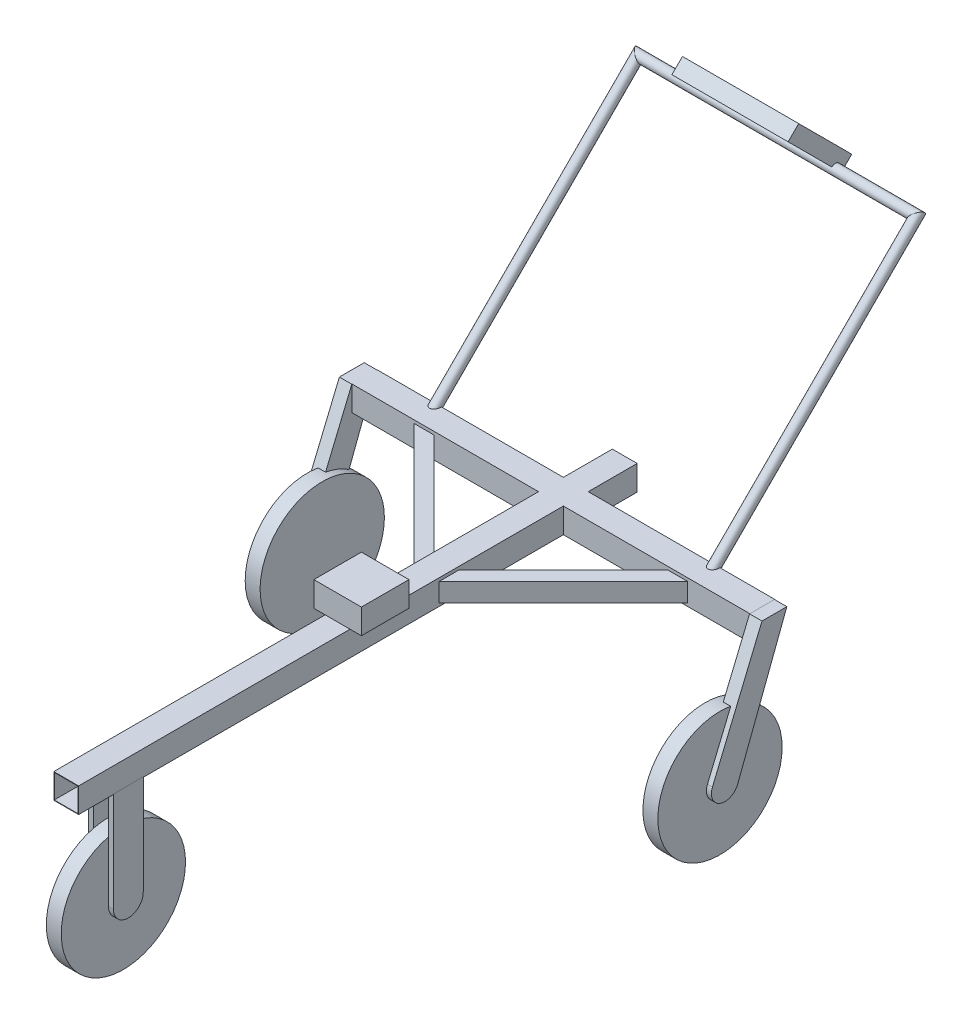
from build123d import *

# Parameters (mm, degrees)
FWD_AFT_BEAM_XS_W         = 50
FWD_AFT_BEAM_XS_H         = 50
FWD_AFT_BEAM_XS_W_2       = 48
FWD_AFT_BEAM_XS_H_2       = 48
LAT_BEAM_XS_W             = 50
LAT_BEAM_XS_H             = 50
LAT_BEAM_XS_W_2           = 48
LAT_BEAM_XS_H_2           = 48
FRONT_WHEEL_SKETCH_R      = 125
BOSS_EXTRUDE1_DEPTH       = 15
REAR_RIGHT_WHEEL_SKETCH_R = 125
BOSS_EXTRUDE2_DEPTH       = 15
REAR_LEFT_WHEEL_SKETCH_R  = 125
BOSS_EXTRUDE3_DEPTH       = 15
SWEEP1_PROFILE_R          = 10
SKETCH14_W                = 40.260144978
SKETCH14_H                = 37.28401926
BOSS_EXTRUDE4_START       = 25
BOSS_EXTRUDE4_DEPTH       = 10
BOSS_EXTRUDE5_START       = 400
BOSS_EXTRUDE5_DEPTH       = 25
SKETCH17_W                = 233.770866628
SKETCH17_H                = 150.987210946
BOSS_EXTRUDE6_DEPTH       = 30
SKETCH20_W                = 95.63546101
SKETCH20_H                = 95.635461009
BOSS_EXTRUDE7_DEPTH       = 50


# Read off the part's stored shape, not the designer's step: Boss-Extrude5
with BuildPart() as part:
    # fwd-aft-beam: sweep along a path in fwd-aft-beam-profile
    with BuildLine(Plane(origin=(0, 350, -250), x_dir=(1, 0, 0), z_dir=(0, -1, 0))) as fwd_aft_beam_path:
        Line((0, 1150), (0, 26.58102252))
    # fwd-aft-beam-xs → fwd-aft-beam (sweep)
    with BuildSketch(Plane.XY):
        with Locations((0, 350)):
            Rectangle(FWD_AFT_BEAM_XS_W, FWD_AFT_BEAM_XS_H)
        with Locations((0, 350)):
            Rectangle(FWD_AFT_BEAM_XS_W_2, FWD_AFT_BEAM_XS_H_2, mode=Mode.SUBTRACT)
    sweep(path=fwd_aft_beam_path.line)

    # lat-beam: sweep along a path in lat-beam-profile
    with BuildLine(Plane(origin=(0, 350, 0), x_dir=(1, 0, 0), z_dir=(0, 1, 0))) as lat_beam_path:
        Line((-400, 100), (400, 100))
    # lat-beam-xs → lat-beam (sweep)
    with BuildSketch(Plane(origin=(0, 0, 0), x_dir=(0, 0, -1), z_dir=(1, 0, 0))):
        with Locations((100, 350)):
            Rectangle(LAT_BEAM_XS_W, LAT_BEAM_XS_H)
        with Locations((100, 350)):
            Rectangle(LAT_BEAM_XS_W_2, LAT_BEAM_XS_H_2, mode=Mode.SUBTRACT)
    sweep(path=lat_beam_path.line)

    # Sweep1: sweep along a path in Sketch1
    with BuildLine(Plane(origin=(0, 125, 125), x_dir=(1, 0, 0), z_dir=(0, 0.7071067811865488, 0.7071067811865464))) as sweep1_path:
        Line((-280, 318.198051534), (-280, 926.610024364))
        Line((-280, 926.610024364), (280, 926.610024364))
        Line((280, 926.610024364), (280, 318.198051534))
    # Sweep1 profile (on start of the path) → Sweep1 (sweep)
    with BuildSketch(Plane(origin=(-280, 350, -100), x_dir=(0, -0.7071067811865488, -0.7071067811865464), z_dir=(0, 0.7071067811865464, -0.7071067811865488))):
        Circle(SWEEP1_PROFILE_R)
    sweep(path=sweep1_path.line, transition=Transition.RIGHT)

    # Sweep2: sweep along a path in frame-sketch
    with BuildLine(Plane(origin=(0, 350, 0), x_dir=(1, 0, 0), z_dir=(0, 1, 0))) as sweep2_path:
        Line((280, 100), (0, -180))
        Line((0, -180), (-280, 100))
    # Sketch14 → Sweep2 (sweep)
    with BuildSketch(Plane.XY.offset(-100)):
        with Locations((-280, 350)):
            Rectangle(SKETCH14_W, SKETCH14_H)
    sweep(path=sweep2_path.line, transition=Transition.RIGHT)


with BuildPart() as body_2:
    # front-wheel-sketch → Boss-Extrude1 (new, symmetric)
    with BuildSketch(Plane(origin=(0, 0, 0), x_dir=(0, 0, -1), z_dir=(1, 0, 0))):
        with Locations((-800, 125)):
            Circle(FRONT_WHEEL_SKETCH_R)
    extrude(amount=BOSS_EXTRUDE1_DEPTH, both=True)


with BuildPart() as body_3:
    # rear-right-wheel-sketch → Boss-Extrude2 (new, symmetric)
    with BuildSketch(Plane(origin=(-400, 0, 0), x_dir=(0, 0, -1), z_dir=(1, 0, 0))):
        with Locations((0, 125)):
            Circle(REAR_RIGHT_WHEEL_SKETCH_R)
    extrude(amount=BOSS_EXTRUDE2_DEPTH, both=True)


with BuildPart() as body_4:
    # rear-left-wheel-sketch → Boss-Extrude3 (new, symmetric)
    with BuildSketch(Plane(origin=(400, 0, 0), x_dir=(0, 0, -1), z_dir=(1, 0, 0))):
        with Locations((0, 125)):
            Circle(REAR_LEFT_WHEEL_SKETCH_R)
    extrude(amount=BOSS_EXTRUDE3_DEPTH, both=True)


with BuildPart() as body_5:
    # Sketch16 → Boss-Extrude4 (new body)
    with BuildSketch(Plane(origin=(0, 0, 0), x_dir=(0, 0, -1), z_dir=(1, 0, 0)).offset(BOSS_EXTRUDE4_START)):
        with BuildLine():
            Line((-830, 375), (-770, 375))
            Line((-770, 375), (-770, 125))
            ThreePointArc((-770, 125), (-800, 95), (-830, 125))
            Line((-830, 125), (-830, 375))
        make_face()
    boss_extrude4 = extrude(amount=-BOSS_EXTRUDE4_DEPTH)


with BuildPart() as body_6:
    # Boss-Extrude5 outline → Boss-Extrude5 (new body)
    with BuildSketch(Plane(origin=(0, 0, 0), x_dir=(0, 0, -1), z_dir=(1, 0, 0)).offset(BOSS_EXTRUDE5_START)):
        with BuildLine():
            Line((74.463590991, 375), (-25.219339933, 135.496452983))
            ThreePointArc((-25.219339933, 135.496452983), (-10.111410838, 99.623830022), (25.527121699, 115.27597359))
            Line((25.527121699, 115.27597359), (124.463590991, 375))
            Line((124.463590991, 375), (74.463590991, 375))
        make_face()
    boss_extrude5 = extrude(amount=BOSS_EXTRUDE5_DEPTH)


with BuildPart() as body_7:
    # Sketch17 → Boss-Extrude6 (new body)
    with BuildSketch(Plane(origin=(0, 655.212231743, -655.212231743), x_dir=(1, 0, 0), z_dir=(0, -0.7071067811865488, 0.7071067811865464))):
        with Locations((0, 235.716812854)):
            Rectangle(SKETCH17_W, SKETCH17_H)
    extrude(amount=-BOSS_EXTRUDE6_DEPTH)


with BuildPart() as part_1:
    add(part.part)

    add(body_2.part)  # Mirror7 merges body 2

    add(body_3.part)  # Mirror7 merges body 3
    # Mirror7: Boss-Extrude4, Boss-Extrude5 across plane
    add(boss_extrude4.mirror(Plane(origin=(0, 0, 0), x_dir=(0, 0, 1), z_dir=(1, 0, 0))))
    add(boss_extrude5.mirror(Plane(origin=(0, 0, 0), x_dir=(0, 0, 1), z_dir=(1, 0, 0))))

    # Sketch20 → Boss-Extrude7 (add)
    with BuildSketch(Plane(origin=(0, 375, 0), x_dir=(1, 0, 0), z_dir=(0, 1, 0))):
        with Locations((0, -306.253298001)):
            Rectangle(SKETCH20_W, SKETCH20_H)
    extrude(amount=BOSS_EXTRUDE7_DEPTH)


solid = Compound([body_4.part, body_5.part, body_6.part, body_7.part, part_1.part])
